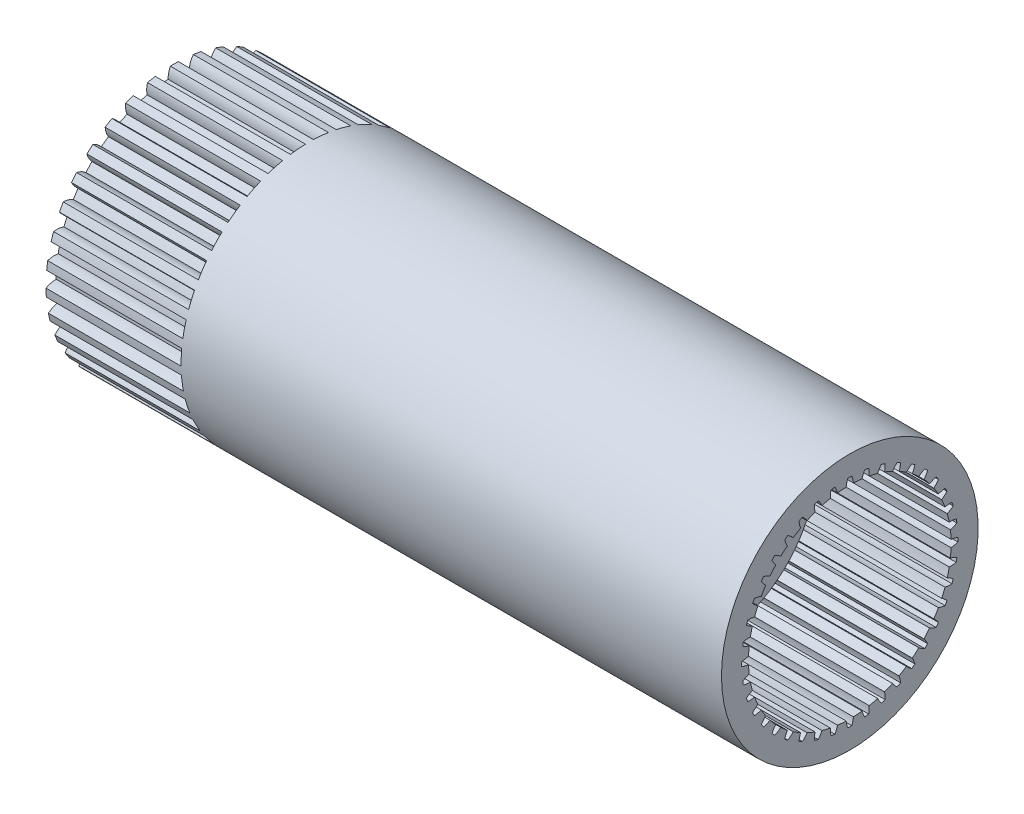
from build123d import *

# Parameters (mm, degrees)
SKETCH1_W           = 100
SKETCH1_H           = 17.5
BOSS_EXTRUDE1_START = -20
BOSS_EXTRUDE1_DEPTH = 20
CIRPATTERN1_COUNT   = 35
BOSS_EXTRUDE2_START = -100
SKETCH3_R           = 19
BOSS_EXTRUDE2_DEPTH = 80
SKETCH4_R           = 15
CUT_EXTRUDE1_DEPTH  = 20
CUT_EXTRUDE2_DEPTH  = 35
CIRPATTERN2_COUNT   = 40


with BuildPart() as part:
    # Sketch1 → Revolve1 (revolve)
    with BuildSketch(Plane.XY, mode=Mode.PRIVATE) as revolve1_sk:
        with Locations((2.211538462, 8.75)):
            Rectangle(SKETCH1_W, SKETCH1_H)
    revolve(revolve1_sk.sketch.rotate(Axis((-50.480769231, 0, 0), (1, 0, 0)), 90), axis=Axis((-50.480769231, 0, 0), (1, 0, 0)))

    # Sketch2 → Boss-Extrude1 (add)
    with BuildSketch(Plane.ZY.offset(47.788461538).offset(BOSS_EXTRUDE1_START)):
        with BuildLine():
            ThreePointArc((-12.187870784, 12.558097219), (-11.513927704, 13.178750655), (-10.808425749, 13.763282052))
            ThreePointArc((-10.808425749, 13.763282052), (-11.371775548, 14.303609976), (-12.049992771, 14.690053581))
            ThreePointArc((-12.049992771, 14.690053581), (-12.500835793, 14.308357854), (-12.939595213, 13.912831333))
            ThreePointArc((-12.939595213, 13.912831333), (-12.647688328, 13.18887855), (-12.187870784, 12.558097219))
        make_face()
    boss_extrude1 = extrude(amount=BOSS_EXTRUDE1_DEPTH)

    # CirPattern1: Boss-Extrude1 ×35 about axis
    cirpattern1_axis = Axis((0, 0, 0), (1, 0, 0))
    for i in range(1, CIRPATTERN1_COUNT):
        add(boss_extrude1.rotate(cirpattern1_axis, i * 360 / CIRPATTERN1_COUNT))

    # Sketch3 → Boss-Extrude2 (add)
    with BuildSketch(Plane.ZY.offset(47.788461538).offset(BOSS_EXTRUDE2_START)):
        Circle(SKETCH3_R)
    extrude(amount=BOSS_EXTRUDE2_DEPTH)

    # Sketch4 → Cut-Extrude1 (cut)
    with BuildSketch(Plane(origin=(52.211538462, 0, 0), x_dir=(0, 0, -1), z_dir=(1, 0, 0))):
        Circle(SKETCH4_R)
    extrude(amount=-CUT_EXTRUDE1_DEPTH, mode=Mode.SUBTRACT)

    # Sketch4<3> → Cut-Extrude2 (cut)
    with BuildSketch(Plane(origin=(52.211538462, 0, 0), x_dir=(0, 0, -1), z_dir=(1, 0, 0))):
        with BuildLine():
            Line((0, 16), (0, 15))
            ThreePointArc((0, 15), (0.268291602, 14.997600462), (0.536497368, 14.990402615))
            ThreePointArc((0.536497368, 14.990402615), (0.448478811, 15.501868697), (0.293907469, 15.997300347))
            ThreePointArc((0.293907469, 15.997300347), (0.146959934, 15.999325073), (0, 16))
        make_face()
        with BuildLine():
            ThreePointArc((-0.536497368, 14.990402615), (-0.268291602, 14.997600462), (0, 15))
            Line((0, 15), (0, 16))
            ThreePointArc((0, 16), (-0.146959934, 15.999325073), (-0.293907469, 15.997300347))
            ThreePointArc((-0.293907469, 15.997300347), (-0.448478811, 15.501868697), (-0.536497368, 14.990402615))
        make_face()
    cut_extrude2 = extrude(amount=-CUT_EXTRUDE2_DEPTH, mode=Mode.SUBTRACT)

    # CirPattern2: Cut-Extrude2 ×40 about axis
    cirpattern2_axis = Axis((0, 0, 0), (1, 0, 0))
    for i in range(1, CIRPATTERN2_COUNT):
        add(cut_extrude2.rotate(cirpattern2_axis, i * 360 / CIRPATTERN2_COUNT), mode=Mode.SUBTRACT)


solid = part.part
